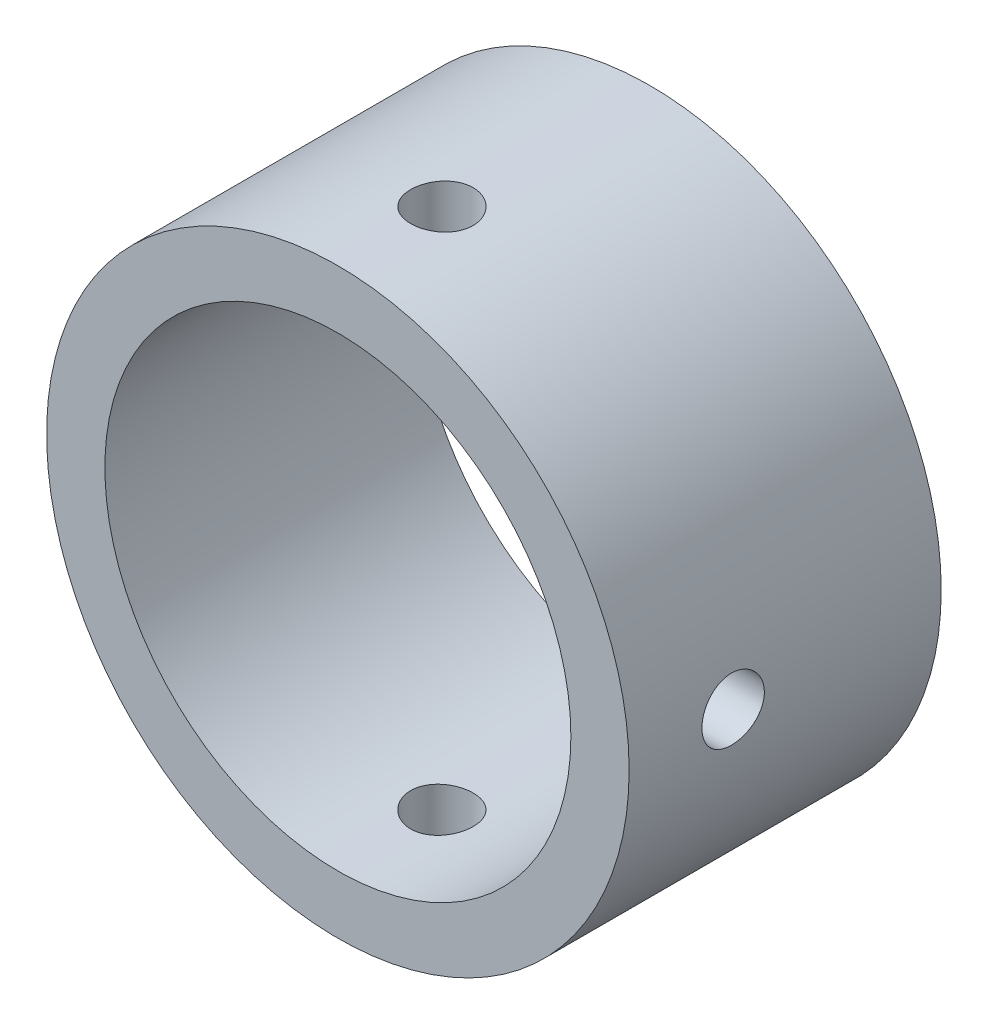
from build123d import *

# Parameters (mm, degrees)
BOSS_EXTRUDE1_DEPTH      = 5
BOSS_EXTRUDE1_DEPTH_BACK = 10
SKETCH1_R                = 14
SKETCH1_R_2              = 11.2
CUT_EXTRUDE1_DEPTH       = 23.181073013
CUT_EXTRUDE1_DEPTH_BACK  = 23.181073013
SKETCH2_R                = 1.5
SKETCH3_R                = 1.5
CUT_EXTRUDE2_DEPTH       = 23.181073203


with BuildPart() as part:
    # Sketch1 → Boss-Extrude1 (new, two sides: drawn at the far end of the back side and taken through both)
    with BuildSketch(Plane.XY.offset(-BOSS_EXTRUDE1_DEPTH_BACK)):
        Circle(SKETCH1_R)
        Circle(SKETCH1_R_2, mode=Mode.SUBTRACT)
    extrude(amount=BOSS_EXTRUDE1_DEPTH + BOSS_EXTRUDE1_DEPTH_BACK)

    # Sketch2 → Cut-Extrude1 (cut, two sides: drawn at the far end of the back side and taken through both)
    with BuildSketch(Plane(origin=(0, 0, 0), x_dir=(1, 0, 0), z_dir=(0, 1, 0)).offset(-CUT_EXTRUDE1_DEPTH_BACK)):
        Circle(SKETCH2_R)
    extrude(amount=CUT_EXTRUDE1_DEPTH + CUT_EXTRUDE1_DEPTH_BACK, mode=Mode.SUBTRACT)

    # Sketch3 → Cut-Extrude2 (cut, through all)
    with BuildSketch(Plane(origin=(0, 0, 0), x_dir=(0, 0, -1), z_dir=(1, 0, 0))):
        Circle(SKETCH3_R)
    extrude(amount=CUT_EXTRUDE2_DEPTH, mode=Mode.SUBTRACT)


solid = part.part
